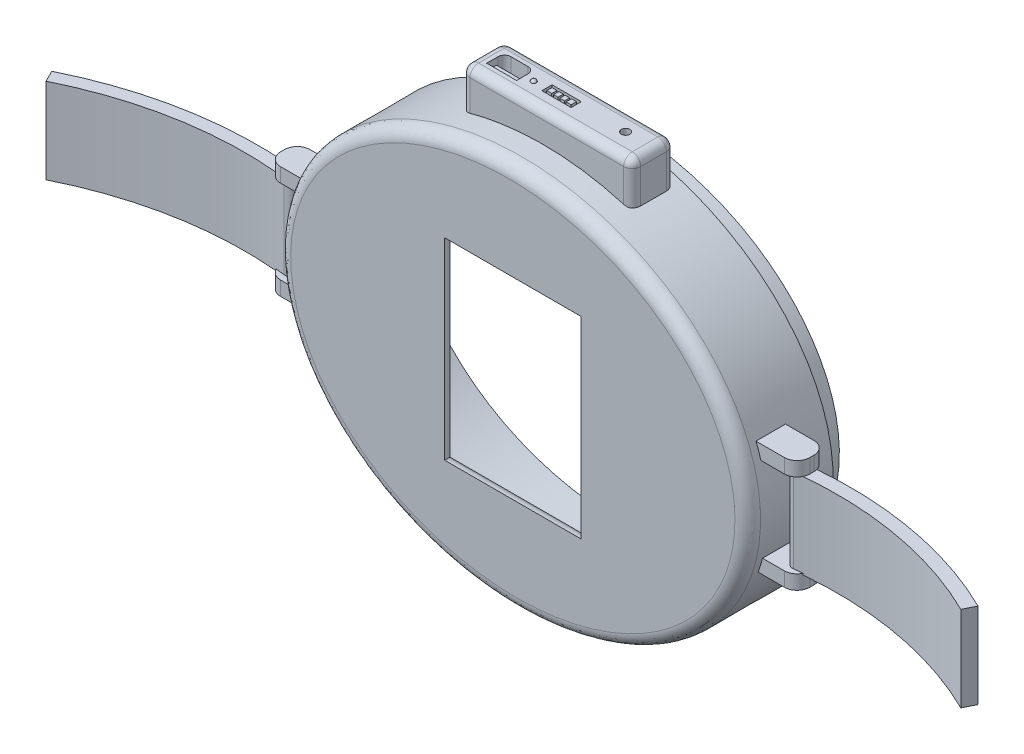
from build123d import *

# Parameters (mm, degrees)
ESQUISSE1_RX            = 55.044250704
ESQUISSE1_RY            = 45.036205122
BOSS_EXTRU_1_DEPTH      = 20
ESQUISSE2_RX            = 49.5
ESQUISSE2_RY            = 39.5
ENL_V_MAT_EXTRU_1_DEPTH = 17
ESQUISSE4_RX            = 51.5
ESQUISSE4_RY            = 41.5
ESQUISSE4_RX_2          = 49.5
ESQUISSE4_RY_2          = 39.5
BOSS_EXTRU_2_DEPTH      = 5
ESQUISSE7_W             = 6.919829832
ESQUISSE7_H             = 3.339012617
BOSS_EXTRU_3_DEPTH      = 10
CONG_2_R                = 3
ESQUISSE8_R             = 1
BOSS_EXTRU_4_DEPTH      = 25
CONG_2_OF_SYM_TRIE1_R   = 3
BOSS_EXTRU_5_DEPTH      = 20
ESQUISSE5_W             = 31.89419249
ESQUISSE5_H             = 45.133012374
ENL_V_MAT_EXTRU_2_DEPTH = 120.503572106
CONG_3_R                = 3
CONG_4_R                = 3
CONG_5_R                = 3
ESQUISSE10_W            = 40
ESQUISSE10_H            = 10
BOSS_EXTRU_6_DEPTH      = 10
CONG_8_R                = 2
ESQUISSE11_W            = 7
ESQUISSE11_H            = 4.173332597
ENL_V_MAT_EXTRU_3_DEPTH = 6
ESQUISSE12_W            = 6.014785938
ESQUISSE12_H            = 1.742951458
BOSS_EXTRU_7_DEPTH      = 5
ESQUISSE13_W            = 0.878813865
ESQUISSE13_H            = 4.609876823
ESQUISSE13_W_2          = 0.874518091
ESQUISSE13_W_3          = 0.882151565
BOSS_EXTRU_8_DEPTH      = 0.5
CHANFREIN2_SIZE         = 2
CONG_9_R                = 1.5
ESQUISSE14_W            = 6.839610381
ESQUISSE14_H            = 2.399626447
ESQUISSE14_W_2          = 1.157274067
ESQUISSE14_H_2          = 1.259691384
ESQUISSE14_W_3          = 1.064830843
ENL_V_MAT_EXTRU_4_DEPTH = 5
ESQUISSE15_R            = 0.608088473
BOSS_EXTRU_9_DEPTH      = 0.5
CONG_11_R               = 0.6
ESQUISSE16_R            = 1
ENL_V_MAT_EXTRU_5_DEPTH = 4


# Some blends are built 0.0001 mm under size
with BuildPart() as part:
    # Esquisse1 → Boss.-Extru.1 (new body)
    with BuildSketch(Plane.XY):
        with Locations(Location((0, 0), (0, 0, -2.297581054))):
            Ellipse(ESQUISSE1_RX, ESQUISSE1_RY)
    extrude(amount=BOSS_EXTRU_1_DEPTH)

    # Esquisse2 → Enlèv. mat.-Extru.1 (cut)
    with BuildSketch(Plane(origin=(0, 0, 0), x_dir=(-1, 0, 0), z_dir=(0, 0, -1))):
        with Locations((0, 0)):
            Ellipse(ESQUISSE2_RX, ESQUISSE2_RY)
    extrude(amount=-ENL_V_MAT_EXTRU_1_DEPTH, mode=Mode.SUBTRACT)

    # Esquisse4 → Boss.-Extru.2 (add)
    with BuildSketch(Plane(origin=(0, 0, 0), x_dir=(-1, 0, 0), z_dir=(0, 0, -1))):
        with Locations(Location((0, 0), (0, 0, 0))):
            Ellipse(ESQUISSE4_RX, ESQUISSE4_RY)
        with Locations((0, 0)):
            Ellipse(ESQUISSE4_RX_2, ESQUISSE4_RY_2, mode=Mode.SUBTRACT)
    extrude(amount=BOSS_EXTRU_2_DEPTH)

    # Esquisse7 → Boss.-Extru.3 (add)
    with BuildSketch(Plane(origin=(62, 0, 0), x_dir=(0, 0, -1), z_dir=(1, 0, 0))):
        with Locations((-11.942859408, -11.493116173)):
            Rectangle(ESQUISSE7_W, ESQUISSE7_H)
        with Locations((-11.942859408, 11.493116173)):
            Rectangle(ESQUISSE7_W, ESQUISSE7_H)
    boss_extru_3 = extrude(amount=-BOSS_EXTRU_3_DEPTH)

    # Congé2
    cong_2_edges = [part.edges().sort_by_distance(p)[0] for p in [
        (62, -11.493116173, 8.482944492),
        (62, -11.493116173, 15.402774324),
        (62, 11.493116173, 15.402774324),
        (62, 11.493116173, 8.482944492),
    ]]
    fillet(cong_2_edges, radius=CONG_2_R)

    # Esquisse8 → Boss.-Extru.4 (add)
    with BuildSketch(Plane(origin=(0, 13.162622481, 0), x_dir=(1, 0, 0), z_dir=(0, 1, 0))):
        with Locations(Location((59.282083168, -11.942859408, 0), (0, 0, 270))):
            Circle(ESQUISSE8_R)
    boss_extru_4 = extrude(amount=-BOSS_EXTRU_4_DEPTH)

    # Symétrie1: Boss.-Extru.3, Boss.-Extru.4 across plane
    add(boss_extru_3.mirror(Plane(origin=(0, 0, 0), x_dir=(0, 0, 1), z_dir=(1, 0, 0))))
    add(boss_extru_4.mirror(Plane(origin=(0, 0, 0), x_dir=(0, 0, 1), z_dir=(1, 0, 0))))

    # Congé2 of Symétrie1
    cong_2_of_sym_trie1_edges = [part.edges().sort_by_distance(p)[0] for p in [
        (-62, -11.493116173, 8.482944492),
        (-62, -11.493116173, 15.402774324),
        (-62, 11.493116173, 15.402774324),
        (-62, 11.493116173, 8.482944492),
    ]]
    fillet(cong_2_of_sym_trie1_edges, radius=CONG_2_OF_SYM_TRIE1_R)

    # Esquisse9 → Boss.-Extru.5 (add)
    with BuildSketch(Plane(origin=(0, 9.823609864, 0), x_dir=(-1, 0, 0), z_dir=(0, -1, 0))):
        with BuildLine():
            Line((-108.476883259, -19.508849727), (-107.144954408, -22.196965338))
            ThreePointArc((-107.144954408, -22.196965338), (-83.985108827, -14.619242753), (-59.627039968, -13.922960884))
            ThreePointArc((-59.627039968, -13.922960884), (-57.96451083, -12.605388546), (-59.282083168, -10.942859408))
            ThreePointArc((-59.282083168, -10.942859408), (-84.49973723, -11.663712748), (-108.476883259, -19.508849727))
        make_face()
    boss_extru_5 = extrude(amount=BOSS_EXTRU_5_DEPTH)

    # Symétrie2: Boss.-Extru.5 across plane
    add(boss_extru_5.mirror(Plane(origin=(0, 0, 0), x_dir=(0, 0, 1), z_dir=(1, 0, 0))))

    # Esquisse5 → Enlèv. mat.-Extru.2 (cut, through all)
    with BuildSketch(Plane(origin=(0, 0, 17), x_dir=(-1, 0, 0), z_dir=(0, 0, -1))):
        Rectangle(ESQUISSE5_W, ESQUISSE5_H)
    extrude(amount=-ENL_V_MAT_EXTRU_2_DEPTH, mode=Mode.SUBTRACT)

    # Congé3
    cong_3_edges = [part.edges().sort_by_distance(p)[0] for p in [
        (49.49999935, -0.006403028, 17),
    ]]
    fillet(cong_3_edges, radius=CONG_3_R)

    # Congé4
    cong_4_edges = [part.edges().sort_by_distance(p)[0] for p in [
        (-55.000202362, 2.201650098, 20),
    ]]
    fillet(cong_4_edges, radius=CONG_4_R)

    # Congé5
    cong_5_edges = [part.edges().sort_by_distance(p)[0] for p in [
        (0, -22.566506187, 17),
        (-15.947096245, 0, 17),
        (15.947096245, 0, 17),
        (0, 22.566506187, 17),
    ]]
    fillet(cong_5_edges, radius=CONG_5_R - 0.0001)  # a hair under: the kernel refuses the full size

    # Esquisse10 → Boss.-Extru.6 (add)
    with BuildSketch(Plane(origin=(0, 52, 0), x_dir=(1, 0, 0), z_dir=(0, 1, 0))):
        with Locations((0, -7.028964456)):
            Rectangle(ESQUISSE10_W, ESQUISSE10_H)
    extrude(amount=-BOSS_EXTRU_6_DEPTH)

    # Congé8
    cong_8_edges = [part.edges().sort_by_distance(p)[0] for p in [
        (0, 52, 12.028964456),
        (20, 47, 12.028964456),
        (20, 52, 7.028964456),
        (20, 47, 2.028964456),
        (0, 52, 2.028964456),
        (-20, 52, 7.028964456),
        (-20, 47.116322181, 12.028964456),
        (-20, 47.116322181, 2.028964456),
    ]]
    fillet(cong_8_edges, radius=CONG_8_R)

    # Esquisse11 → Enlèv. mat.-Extru.3 (cut)
    with BuildSketch(Plane(origin=(0, 52, 0), x_dir=(1, 0, 0), z_dir=(0, 1, 0))):
        with Locations((-13.504100754, -7.028964457)):
            Rectangle(ESQUISSE11_W, ESQUISSE11_H)
    extrude(amount=-ENL_V_MAT_EXTRU_3_DEPTH, mode=Mode.SUBTRACT)

    # Esquisse12 → Boss.-Extru.7 (add)
    with BuildSketch(Plane(origin=(0, 46, 0), x_dir=(1, 0, 0), z_dir=(0, 1, 0))):
        with Locations((-13.453147174, -8.244155026)):
            Rectangle(ESQUISSE12_W, ESQUISSE12_H)
    extrude(amount=BOSS_EXTRU_7_DEPTH)

    # Esquisse13 → Boss.-Extru.8 (add)
    with BuildSketch(Plane(origin=(0, 0, 7.372679297), x_dir=(-1, 0, 0), z_dir=(0, 0, -1))):
        with Locations((13.448638888, 48.304938412)):
            Rectangle(ESQUISSE13_W, ESQUISSE13_H)
        with Locations((11.558831895, 48.304938412)):
            Rectangle(ESQUISSE13_W_2, ESQUISSE13_H)
        with Locations((15.343645716, 48.304938412)):
            Rectangle(ESQUISSE13_W_3, ESQUISSE13_H)
    extrude(amount=BOSS_EXTRU_8_DEPTH)

    # Chanfrein2
    # the kernel refuses this chamfer: 2 mm, written as the material it takes off along each edge
    with BuildSketch(Plane(origin=(-11.121572849, 50.609876823, 6.872679297), x_dir=(0, -0.9996219169112968, -0.02749587661058651), z_dir=(-1, 0, 0))) as chanfrein2_piece_1_section:
        Polygon((CHANFREIN2_SIZE * 0.999621916911, CHANFREIN2_SIZE * 0.0274958766106), (-CHANFREIN2_SIZE * 0.0274958766106, CHANFREIN2_SIZE * 0.999621916911), (0, 0), align=None)
    chanfrein2_piece_1 = extrude(amount=6.017884067, mode=Mode.PRIVATE)
    chanfrein2_piece_1 = split(chanfrein2_piece_1, bisect_by=Plane(origin=(-11.558831895, 49.728924442, 7.372679297), z_dir=(0, 0, -1)), keep=Keep.TOP, mode=Mode.PRIVATE)
    chanfrein2_piece_1 = split(chanfrein2_piece_1, bisect_by=Plane(origin=(-15.784721498, 49.728924442, 7.110774535), z_dir=(1, 0, 0)), keep=Keep.TOP, mode=Mode.PRIVATE)
    add(chanfrein2_piece_1, mode=Mode.SUBTRACT)
    with BuildSketch(Plane(origin=(-7.86586598, 50.609876823, 6.872679297), x_dir=(0, -0.9996219169112968, -0.02749587661058651), z_dir=(-1, 0, 0))) as chanfrein2_piece_2_section:
        Polygon((CHANFREIN2_SIZE * 0.999621916911, CHANFREIN2_SIZE * 0.0274958766106), (-CHANFREIN2_SIZE * 0.0274958766106, CHANFREIN2_SIZE * 0.999621916911), (0, 0), align=None)
    chanfrein2_piece_2 = extrude(amount=11.165545816, mode=Mode.PRIVATE)
    chanfrein2_piece_2 = split(chanfrein2_piece_2, bisect_by=Plane(origin=(-11.558831895, 49.728924442, 7.372679297), z_dir=(0, 0, -1)), keep=Keep.TOP, mode=Mode.PRIVATE)
    chanfrein2_piece_2 = split(chanfrein2_piece_2, bisect_by=Plane(origin=(-15.784721498, 49.728924442, 7.110774535), z_dir=(1, 0, 0)), keep=Keep.TOP, mode=Mode.PRIVATE)
    chanfrein2_piece_2 = split(chanfrein2_piece_2, bisect_by=Plane(origin=(-11.121572849, 49.728924442, 7.110774535), z_dir=(-1, 0, 0)), keep=Keep.TOP, mode=Mode.PRIVATE)
    add(chanfrein2_piece_2, mode=Mode.SUBTRACT)
    with BuildSketch(Plane(origin=(-15.784721498, 50.609876823, 6.872679297), x_dir=(0, -0.9996219169112968, -0.02749587661058651), z_dir=(1, 0, 0))) as chanfrein2_piece_3_section:
        Polygon((CHANFREIN2_SIZE * 0.999621916911, -CHANFREIN2_SIZE * 0.0274958766106), (-CHANFREIN2_SIZE * 0.0274958766106, -CHANFREIN2_SIZE * 0.999621916911), (0, 0), align=None)
    chanfrein2_piece_3 = extrude(amount=6.025517541, mode=Mode.PRIVATE)
    chanfrein2_piece_3 = split(chanfrein2_piece_3, bisect_by=Plane(origin=(-15.343645716, 49.728924442, 7.372679297), z_dir=(0, 0, -1)), keep=Keep.TOP, mode=Mode.PRIVATE)
    chanfrein2_piece_3 = split(chanfrein2_piece_3, bisect_by=Plane(origin=(-11.121572849, 49.728924442, 7.110774535), z_dir=(-1, 0, 0)), keep=Keep.TOP, mode=Mode.PRIVATE)
    add(chanfrein2_piece_3, mode=Mode.SUBTRACT)

    # Congé9
    cong_9_edges = [part.edges().sort_by_distance(p)[0] for p in [
        (-10.004100754, 49, 4.942298158),
        (-17.004100754, 49, 4.942298158),
    ]]
    fillet(cong_9_edges, radius=CONG_9_R)

    # Esquisse14 → Enlèv. mat.-Extru.4 (cut)
    with BuildSketch(Plane(origin=(0, 52, 0), x_dir=(1, 0, 0), z_dir=(0, 1, 0))):
        with Locations((-1.54344879, -7.028964457)):
            Rectangle(ESQUISSE14_W, ESQUISSE14_H)
        with Locations((-3.814649415, -7.028964456)):
            Rectangle(ESQUISSE14_W_2, ESQUISSE14_H_2, mode=Mode.SUBTRACT)
        with Locations((0.727751835, -7.028964456)):
            Rectangle(ESQUISSE14_W_2, ESQUISSE14_H_2, mode=Mode.SUBTRACT)
        with Locations((-2.285108461, -7.028964456)):
            Rectangle(ESQUISSE14_W_3, ESQUISSE14_H_2, mode=Mode.SUBTRACT)
        with Locations((-0.801789119, -7.028964456)):
            Rectangle(ESQUISSE14_W_3, ESQUISSE14_H_2, mode=Mode.SUBTRACT)
    extrude(amount=-ENL_V_MAT_EXTRU_4_DEPTH, mode=Mode.SUBTRACT)

    # Esquisse15 → Boss.-Extru.9 (add)
    with BuildSketch(Plane(origin=(0, 52, 0), x_dir=(1, 0, 0), z_dir=(0, 1, 0))):
        with Locations(Location((-7.805569462, -7.297604121, 0), (0, 0, 90))):
            Circle(ESQUISSE15_R)
    extrude(amount=BOSS_EXTRU_9_DEPTH)

    # Congé11
    # the kernel refuses this fillet: 0.6 mm, written as the material it takes off along each edge
    with BuildSketch(Plane(origin=(-7.805569462, 52.5, 7.297604121), x_dir=(0, 0, -1), z_dir=(1, 0, 0))) as cong_11_piece_1:
        with BuildLine():
            CenterArc((0.016480494, -0.6), CONG_11_R, 9.594068227, 80.405931773)
            Line((0.016480494, 0), (0.016480494, 0.012))
            Line((0.016480494, 0.012), (0.608088473, 0.012))
            Line((0.608088473, 0.012), (0.620088473, 0))
            ThreePointArc((0.620088473, 0), (0.620088473, -0.25), (0.619920632, -0.498))
            Line((0.619920632, -0.498), (0.608088473, -0.5))
        make_face()
    revolve(axis=Axis((-7.805569462, 52.5, 7.297604121), (0, 1, 0)), mode=Mode.SUBTRACT)

    # Esquisse16 → Enlèv. mat.-Extru.5 (cut)
    with BuildSketch(Plane(origin=(0, 52, 0), x_dir=(1, 0, 0), z_dir=(0, 1, 0))):
        with Locations(Location((13.184483348, -6.765528906, 0), (0, 0, 270))):
            Circle(ESQUISSE16_R)
    extrude(amount=-ENL_V_MAT_EXTRU_5_DEPTH, mode=Mode.SUBTRACT)


solid = part.part
